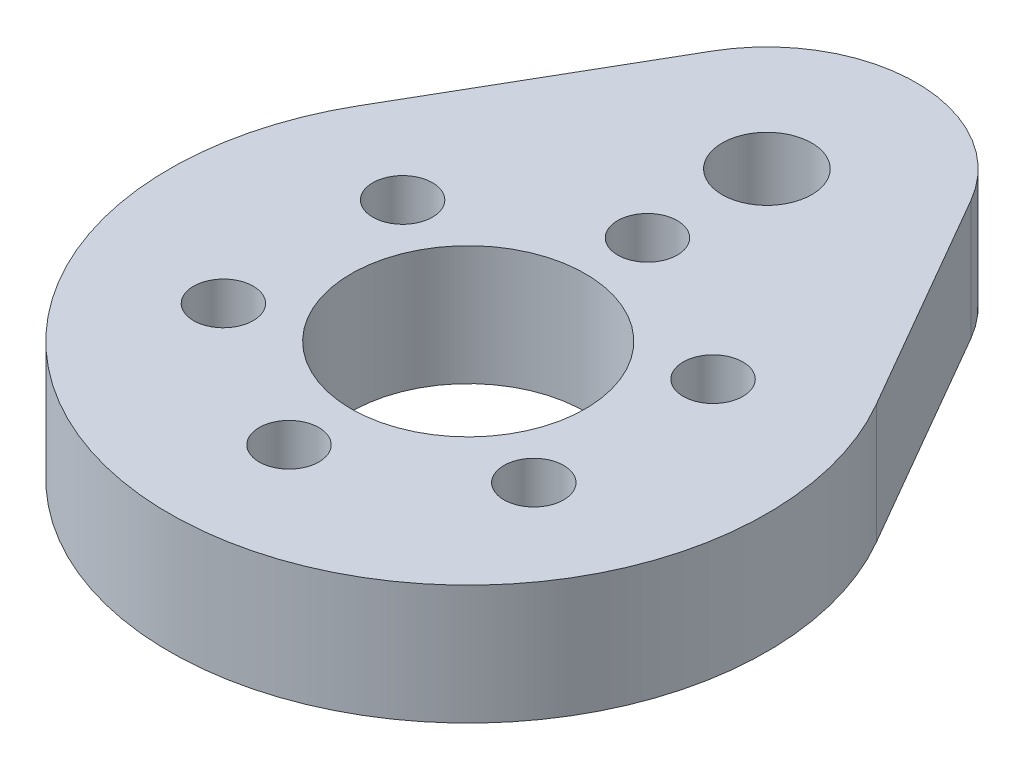
from build123d import *

# Parameters (mm, degrees)
SKETCH1_R           = 4.979156699
SKETCH1_R_2         = 1.27
SKETCH1_R_3         = 1.905
BOSS_EXTRUDE1_DEPTH = 5.08


with BuildPart() as part:
    # Sketch1 → Boss-Extrude1 (new body)
    with BuildSketch(Plane(origin=(0, 0, 0), x_dir=(1, 0, 0), z_dir=(0, 1, 0))):
        with BuildLine():
            Line((-5.499261314, 15.875), (-10.998522628, 6.35))
            ThreePointArc((-10.998522628, 6.35), (0, -12.7), (10.998522628, 6.35))
            Line((10.998522628, 6.35), (5.499261314, 15.875))
            ThreePointArc((5.499261314, 15.875), (0, 19.05), (-5.499261314, 15.875))
        make_face()
        Circle(SKETCH1_R, mode=Mode.SUBTRACT)
        with Locations((0, 7.62)):
            Circle(SKETCH1_R_2, mode=Mode.SUBTRACT)
        with Locations((6.599113577, 3.81)):
            Circle(SKETCH1_R_2, mode=Mode.SUBTRACT)
        with Locations((6.599113577, -3.81)):
            Circle(SKETCH1_R_2, mode=Mode.SUBTRACT)
        with Locations((0, -7.62)):
            Circle(SKETCH1_R_2, mode=Mode.SUBTRACT)
        with Locations((-6.599113577, -3.81)):
            Circle(SKETCH1_R_2, mode=Mode.SUBTRACT)
        with Locations((-6.599113577, 3.81)):
            Circle(SKETCH1_R_2, mode=Mode.SUBTRACT)
        with Locations((0, 12.7)):
            Circle(SKETCH1_R_3, mode=Mode.SUBTRACT)
    extrude(amount=BOSS_EXTRUDE1_DEPTH)


solid = part.part
